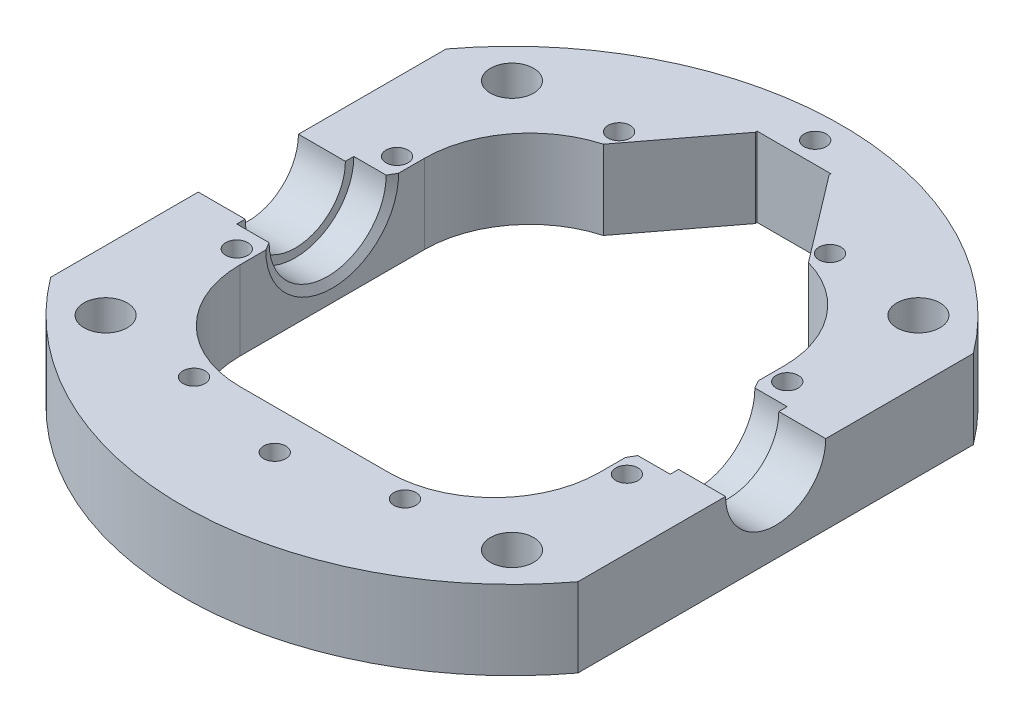
from build123d import *
from OCP.BRepFilletAPI import BRepFilletAPI_MakeChamfer

# Parameters (mm, degrees)
SKETCH2_R               = 62.5
SKETCH2_W               = 68.2
SKETCH2_H               = 75
BOSS_EXTRUDE1_DEPTH     = 15
SKETCH7_W               = 7
SKETCH7_H               = 11.1
CUT_EXTRUDE1_DEPTH      = 122.918866465
CUT_EXTRUDE1_DEPTH_BACK = 122.918866465
SKETCH8_R               = 9.5
FILLET1_R               = 20
SKETCH9_R               = 2.1
CUT_EXTRUDE2_DEPTH      = 90.652105542
CHAMFER1_SIZE           = 1.5
CHAMFER1_SIZE2          = 0.866025404
SKETCH10_R              = 4.1
CUT_EXTRUDE3_DEPTH      = 90.652105542
CUT_EXTRUDE4_DEPTH      = 90.652105542
SKETCH12_W              = 14
SKETCH12_H              = 16
CUT_EXTRUDE5_DEPTH      = 90.652105542
CHAMFER2_DEPTH          = 15
CUT_EXTRUDE6_DEPTH      = 90.652105542


with BuildPart() as part:
    # Sketch2 → Boss-Extrude1 (new body)
    with BuildSketch(Plane(origin=(0, 0, 0), x_dir=(1, 0, 0), z_dir=(0, 1, 0))):
        with Locations(Location((0, 0, 0), (0, 0, 270))):
            Circle(SKETCH2_R)
        Rectangle(SKETCH2_W, SKETCH2_H, mode=Mode.SUBTRACT)
    extrude(amount=BOSS_EXTRUDE1_DEPTH)

    # Sketch7 → Cut-Revolve2 (revolve, cut)
    with BuildSketch(Plane(origin=(0, 15, 0), x_dir=(1, 0, 0), z_dir=(0, 1, 0))):
        with Locations((-37.6, 5.55)):
            Rectangle(SKETCH7_W, SKETCH7_H)
        with Locations((37.6, 5.55)):
            Rectangle(SKETCH7_W, SKETCH7_H)
    revolve(axis=Axis((62.5, 15, 0), (-1, 0, 0)), mode=Mode.SUBTRACT)

    # Sketch8 → Cut-Extrude1 (cut, two sides: drawn at the far end of the back side and taken through both)
    with BuildSketch(Plane.ZY.offset(-41.1).offset(-CUT_EXTRUDE1_DEPTH_BACK)):
        with Locations((0, 15)):
            Circle(SKETCH8_R)
    extrude(amount=CUT_EXTRUDE1_DEPTH + CUT_EXTRUDE1_DEPTH_BACK, mode=Mode.SUBTRACT)

    # Fillet1
    fillet1_edges = [part.edges().sort_by_distance(p)[0] for p in [
        (-34.1, 7.5, -37.5),
        (-34.1, 7.5, 37.5),
        (34.1, 7.5, 37.5),
        (34.1, 7.5, -37.5),
    ]]
    fillet(fillet1_edges, radius=FILLET1_R)

    # Sketch9 → Cut-Extrude2 (cut, through all)
    with BuildSketch(Plane(origin=(0, 15, 0), x_dir=(1, 0, 0), z_dir=(0, 1, 0))):
        with Locations(Location((-37, 15.198684154, 0), (0, 0, 270))):
            Circle(SKETCH9_R)
        with Locations(Location((37, 15.198684154, 0), (0, 0, 270))):
            Circle(SKETCH9_R)
        with Locations(Location((37, -15.198684154, 0), (0, 0, 270))):
            Circle(SKETCH9_R)
        with Locations(Location((-37, -15.198684154, 0), (0, 0, 270))):
            Circle(SKETCH9_R)
        with Locations(Location((-20, 40.311288741, 0), (0, 0, 270))):
            Circle(SKETCH9_R)
        with Locations(Location((20, 40.311288741, 0), (0, 0, 270))):
            Circle(SKETCH9_R)
        with Locations(Location((20, -40.311288741, 0), (0, 0, 270))):
            Circle(SKETCH9_R)
        with Locations(Location((-20, -40.311288741, 0), (0, 0, 270))):
            Circle(SKETCH9_R)
        with Locations(Location((0, -45, 0), (0, 0, 270))):
            Circle(SKETCH9_R)
        with Locations(Location((0, 57.5, 0), (0, 0, 270))):
            Circle(SKETCH9_R)
    extrude(amount=-CUT_EXTRUDE2_DEPTH, mode=Mode.SUBTRACT)

    # Chamfer1: one chamfer whose edges measure the first distance from different faces: ONE call of the kernel's chamfer builder (chamfer() names one face for all edges)
    chamfer1_edges_1 = [part.edges().sort_by_distance(p)[0] for p in [
        (-34.1, 3.9, 0),
    ]]
    chamfer1_side_1 = [part.faces().sort_by_distance(p)[0] for p in [
        (-34.1, 0.380788655, 0),
    ]]
    chamfer1_edges_2 = [part.edges().sort_by_distance(p)[0] for p in [
        (34.1, 3.9, 0),
    ]]
    chamfer1_side_2 = [part.faces().sort_by_distance(p)[0] for p in [
        (34.1, 0.380788655, 0),
    ]]
    chamfer1 = BRepFilletAPI_MakeChamfer(part.part.solid().wrapped)
    for e in chamfer1_edges_1:
        chamfer1.Add(CHAMFER1_SIZE, CHAMFER1_SIZE2, e.wrapped, chamfer1_side_1[0].wrapped)  # the first distance lies on this face
    for e in chamfer1_edges_2:
        chamfer1.Add(CHAMFER1_SIZE, CHAMFER1_SIZE2, e.wrapped, chamfer1_side_2[0].wrapped)  # the first distance lies on this face
    add(Compound.cast(chamfer1.Shape()), mode=Mode.REPLACE)

    # Sketch10 → Cut-Extrude3 (cut, through all)
    with BuildSketch(Plane.XZ):
        with Locations(Location((38.537319575, -38.537319575, 0), (0, 0, 270))):
            Circle(SKETCH10_R)
        with Locations(Location((-38.537319575, -38.537319575, 0), (0, 0, 270))):
            Circle(SKETCH10_R)
        with Locations(Location((-38.537319575, 38.537319575, 0), (0, 0, 270))):
            Circle(SKETCH10_R)
        with Locations(Location((38.537319575, 38.537319575, 0), (0, 0, 270))):
            Circle(SKETCH10_R)
    extrude(amount=-CUT_EXTRUDE3_DEPTH, mode=Mode.SUBTRACT)

    # Sketch11 → Cut-Extrude4 (cut, through all)
    with BuildSketch(Plane.XZ):
        with BuildLine():
            Line((50, -37.5), (50, 37.5))
            ThreePointArc((50, 37.5), (62.5, 0), (50, -37.5))
        make_face()
    extrude(amount=-CUT_EXTRUDE4_DEPTH, mode=Mode.SUBTRACT)

    # Sketch12 → Cut-Extrude5 (cut, through all)
    with BuildSketch(Plane(origin=(0, 15, 0), x_dir=(1, 0, 0), z_dir=(0, 1, 0))):
        with Locations((0, 45.5)):
            Rectangle(SKETCH12_W, SKETCH12_H)
    extrude(amount=-CUT_EXTRUDE5_DEPTH, mode=Mode.SUBTRACT)

    # Chamfer2: read off the stored shape, not the designer's step
    # Chamfer2 outline → Chamfer2 (cut)
    with BuildSketch(Plane(origin=(0, 0, 0), x_dir=(1, 0, 0), z_dir=(0, 1, 0))):
        with BuildLine():
            ThreePointArc((14.1, 37.5), (16.800403682, 37.316856965), (19.451351351, 36.770781996))
            Line((19.451351351, 36.770781996), (7, 53.150946691))
            Line((7, 53.150946691), (7, 37.5))
            Line((7, 37.5), (14.1, 37.5))
        make_face()
        with BuildLine():
            Line((-7, 37.5), (-7, 53.150946691))
            Line((-7, 53.150946691), (-19.451351351, 36.770781996))
            ThreePointArc((-19.451351351, 36.770781996), (-16.800403682, 37.316856965), (-14.1, 37.5))
            Line((-14.1, 37.5), (-7, 37.5))
        make_face()
    extrude(amount=CHAMFER2_DEPTH, mode=Mode.SUBTRACT)

    # Sketch13 → Cut-Extrude6 (cut, through all)
    with BuildSketch(Plane.XZ):
        with BuildLine():
            Line((-50, -37.5), (-50, 37.5))
            ThreePointArc((-50, 37.5), (-62.5, 0), (-50, -37.5))
        make_face()
    extrude(amount=-CUT_EXTRUDE6_DEPTH, mode=Mode.SUBTRACT)


solid = part.part
